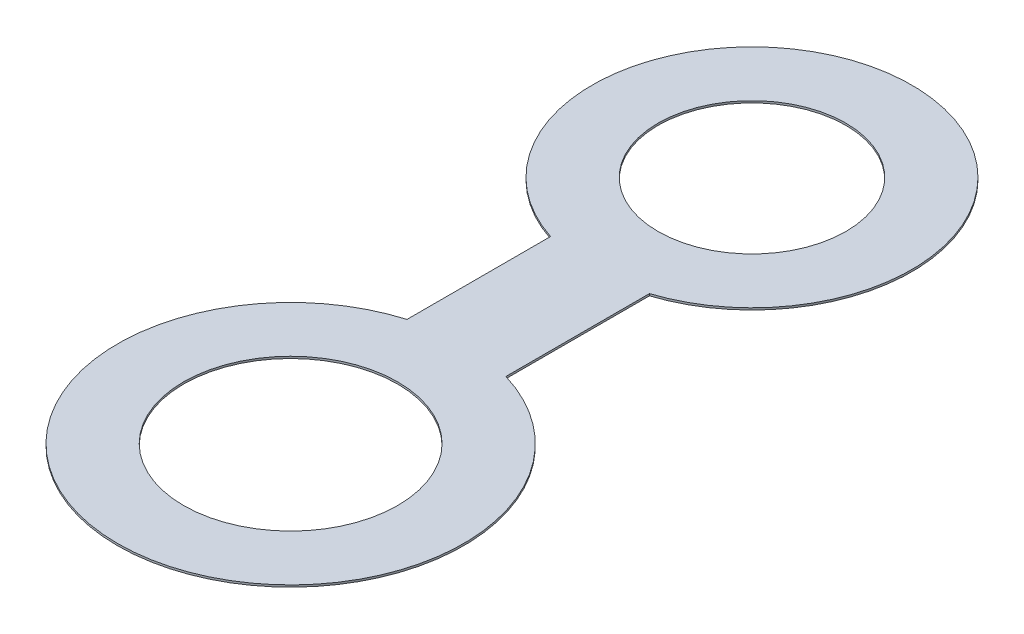
from build123d import *

# Parameters (mm, degrees)
SKETCH1_R           = 14.25
SKETCH1_R_2         = 16.25
BOSS_EXTRUDE1_DEPTH = 0.3


with BuildPart() as part:
    # Sketch1 → Boss-Extrude1 (new body)
    with BuildSketch(Plane(origin=(0, 0, 0), x_dir=(1, 0, 0), z_dir=(0, 1, 0))):
        with BuildLine():
            Line((-7.5, 46.938939747), (-7.5, 25.155764747))
            ThreePointArc((-7.5, 25.155764747), (0, -26.25), (7.5, 25.155764747))
            Line((7.5, 25.155764747), (7.5, 46.938939747))
            ThreePointArc((7.5, 46.938939747), (0, 94.25), (-7.5, 46.938939747))
        make_face()
        with Locations((0, 70)):
            Circle(SKETCH1_R, mode=Mode.SUBTRACT)
        Circle(SKETCH1_R_2, mode=Mode.SUBTRACT)
    extrude(amount=BOSS_EXTRUDE1_DEPTH)


solid = part.part
